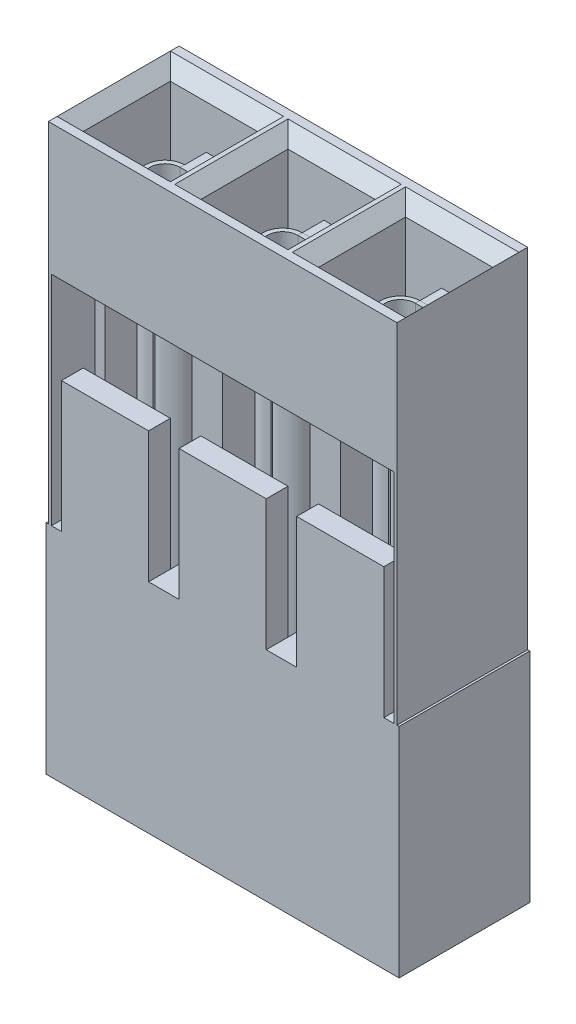
from build123d import *

# Parameters (mm, degrees)
SCHIZZO1_W                        = 8
SCHIZZO1_H                        = 8
ESTRUSIONE_ESTRUSIONE1_DEPTH      = 3
SCHIZZO2_W                        = 7.86
SCHIZZO2_H                        = 5
TAGLIO_ESTRUSIONE2_DEPTH          = 1
ESTRUSIONE_ESTRUSIONE2_DEPTH      = 1
ESTRUSIONE_ESTRUSIONE2_DEPTH_BACK = 2
SCHIZZO4_W                        = 8.1
SCHIZZO4_H                        = 5
TAGLIO_ESTRUSIONE3_DEPTH          = 14.942829698
TAGLIO_ESTRUSIONE3_DEPTH_BACK     = 14.942829698
SCHIZZO5_W                        = 2
SCHIZZO5_H                        = 2
SMUSSO2_SIZE                      = 0.3
SCHIZZO6_W                        = 2
SCHIZZO6_H                        = 0.5
ESTRUSIONE_ESTRUSIONE4_DEPTH      = 3
SCHIZZO7_W                        = 1.25
SCHIZZO7_H                        = 10
BASE_FLANGIA1_DEPTH               = 0.1
ORLO1_START                       = -7.3
ORLO1_DEPTH                       = 10
ORLO1_2_DEPTH                     = 10
ORLO2_START                       = -7.3
ORLO2_DEPTH                       = 10
ORLO2_2_DEPTH                     = 10
SCHIZZO17_W                       = 1.25
SCHIZZO17_H                       = 10
BASE_FLANGIA2_DEPTH               = 0.1
ORLO3_START                       = -7.3
ORLO3_DEPTH                       = 10
ORLO3_2_DEPTH                     = 10
SCHIZZO26_W                       = 1.25
SCHIZZO26_H                       = 10
BASE_FLANGIA3_DEPTH               = 0.1
ORLO4_START                       = -7.3
ORLO4_DEPTH                       = 10
ORLO4_2_DEPTH                     = 10
ORLO5_START                       = -7.3
ORLO5_DEPTH                       = 10
ORLO5_2_DEPTH                     = 10
ESTRUSIONE_ESTRUSIONE5_REACH      = 15.943
SCHIZZO37_W                       = 0.35
SCHIZZO37_H                       = 0.5


# Read off the part's stored shape, not the designer's step: Orlo1, Orlo2, Orlo3, Orlo4, Orlo5
# Sheet-metal steps are written as plain solids
with BuildPart() as part:
    # Schizzo1 → Estrusione-Estrusione1 (new body)
    with BuildSketch(Plane.XY):
        Rectangle(SCHIZZO1_W, SCHIZZO1_H)
    extrude(amount=ESTRUSIONE_ESTRUSIONE1_DEPTH)

    # Schizzo2 → Taglio-Estrusione2 (cut)
    with BuildSketch(Plane.XY.offset(3)):
        with Locations((0, -1.5)):
            Rectangle(SCHIZZO2_W, SCHIZZO2_H)
    extrude(amount=-TAGLIO_ESTRUSIONE2_DEPTH, mode=Mode.SUBTRACT)

    # Schizzo4 → Estrusione-Estrusione2 (add, two sides: drawn at the far end of the back side and taken through both)
    with BuildSketch(Plane.XY.offset(2).offset(-ESTRUSIONE_ESTRUSIONE2_DEPTH_BACK)):
        with Locations((0, -6.5)):
            Rectangle(SCHIZZO4_W, SCHIZZO4_H)
    extrude(amount=ESTRUSIONE_ESTRUSIONE2_DEPTH + ESTRUSIONE_ESTRUSIONE2_DEPTH_BACK)

    # Schizzo5 → Taglio-Estrusione3 (cut, two sides: drawn at the far end of the back side and taken through both)
    with BuildSketch(Plane.XZ.offset(9).offset(-TAGLIO_ESTRUSIONE3_DEPTH_BACK)):
        with Locations((-2.7, 1.5)):
            Rectangle(SCHIZZO5_W, SCHIZZO5_H)
        with Locations((0, 1.5)):
            Rectangle(SCHIZZO5_W, SCHIZZO5_H)
        with Locations((2.7, 1.5)):
            Rectangle(SCHIZZO5_W, SCHIZZO5_H)
    extrude(amount=TAGLIO_ESTRUSIONE3_DEPTH + TAGLIO_ESTRUSIONE3_DEPTH_BACK, mode=Mode.SUBTRACT)

    # Smusso2
    smusso2_edges = [part.edges().sort_by_distance(p)[0] for p in [
        (0, 4, 2.5),
        (0, 4, 0.5),
        (3.7, 4, 1.5),
        (1.7, 4, 1.5),
        (2.7, 4, 2.5),
        (2.7, 4, 0.5),
        (-1.7, 4, 1.5),
        (-3.7, 4, 1.5),
        (-2.7, 4, 2.5),
        (-2.7, 4, 0.5),
        (1, 4, 1.5),
        (-1, 4, 1.5),
    ]]
    chamfer(smusso2_edges, length=SMUSSO2_SIZE - 0.0001)  # a hair under: the kernel refuses the full size

    # Schizzo6 → Estrusione-Estrusione4 (add)
    with BuildSketch(Plane(origin=(0, -4, 0), x_dir=(1, 0, 0), z_dir=(0, 1, 0))):
        with Locations((-2.7, -2.75)):
            Rectangle(SCHIZZO6_W, SCHIZZO6_H)
        with Locations((0, -2.75)):
            Rectangle(SCHIZZO6_W, SCHIZZO6_H)
        with Locations((2.7, -2.75)):
            Rectangle(SCHIZZO6_W, SCHIZZO6_H)
    extrude(amount=ESTRUSIONE_ESTRUSIONE4_DEPTH)


with BuildPart() as body_2:
    # Schizzo7 → Base-Flangia1 (new body)
    with BuildSketch(Plane.XY.offset(1)):
        with Locations((-2.7, -2.3)):
            Rectangle(SCHIZZO7_W, SCHIZZO7_H)
    extrude(amount=BASE_FLANGIA1_DEPTH)

    # Orlo1 outline → Orlo1 (cut)
    with BuildSketch(Plane(origin=(0, 0, 0), x_dir=(1, 0, 0), z_dir=(0, 1, 0)).offset(ORLO1_START)):
        with BuildLine():
            ThreePointArc((-2.525, -1), (-2.375, -1.025735931), (-2.242157287, -1.1))
            Line((-2.242157287, -1.1), (-2.075, -1.1))
            Line((-2.075, -1.1), (-2.075, -1))
            Line((-2.075, -1), (-2.525, -1))
        make_face()
    extrude(amount=ORLO1_DEPTH, mode=Mode.SUBTRACT)

    # Orlo1 2 outline → Orlo1 2 (add)
    with BuildSketch(Plane(origin=(0, 0, 0), x_dir=(1, 0, 0), z_dir=(0, 1, 0)).offset(ORLO1_START)):
        with BuildLine():
            Line((-2.64470705, -1.778892417), (-2.678909064, -1.872861679))
            ThreePointArc((-2.678909064, -1.872861679), (-2.133228682, -1.671393845), (-2.242157287, -1.1))
            Line((-2.242157287, -1.1), (-2.525, -1.1))
            ThreePointArc((-2.525, -1.1), (-2.180317286, -1.510776862), (-2.64470705, -1.778892417))
        make_face()
    extrude(amount=ORLO1_2_DEPTH)

    # Orlo2 outline → Orlo2 (cut)
    with BuildSketch(Plane(origin=(0, 0, 0), x_dir=(1, 0, 0), z_dir=(0, 1, 0)).offset(ORLO2_START)):
        with BuildLine():
            Line((-3.325, -1.1), (-3.157842713, -1.1))
            ThreePointArc((-3.157842713, -1.1), (-3.025, -1.025735931), (-2.875, -1))
            Line((-2.875, -1), (-3.325, -1))
            Line((-3.325, -1), (-3.325, -1.1))
        make_face()
    extrude(amount=ORLO2_DEPTH, mode=Mode.SUBTRACT)

    # Orlo2 2 outline → Orlo2 2 (add)
    with BuildSketch(Plane(origin=(0, 0, 0), x_dir=(1, 0, 0), z_dir=(0, 1, 0)).offset(ORLO2_START)):
        with BuildLine():
            Line((-2.721090936, -1.872861679), (-2.75529295, -1.778892417))
            ThreePointArc((-2.75529295, -1.778892417), (-3.219682714, -1.510776862), (-2.875, -1.1))
            Line((-2.875, -1.1), (-3.157842713, -1.1))
            ThreePointArc((-3.157842713, -1.1), (-3.266771318, -1.671393845), (-2.721090936, -1.872861679))
        make_face()
    extrude(amount=ORLO2_2_DEPTH)

    # Estrusione-Estrusione5: up to this face of the body (flat: up to its plane)
    estrusione_estrusione5_end = Plane(body_2.part.faces().sort_by_distance((-2.7, 2.7, 1.015402922))[0])
    # Schizzo37 → Estrusione-Estrusione5 (add, up to the picked face)
    with BuildSketch(Plane.XZ.offset(9), mode=Mode.PRIVATE) as estrusione_estrusione5_sk1:
        with Locations((-2.7, 0.75)):
            Rectangle(SCHIZZO37_W, SCHIZZO37_H)
    estrusione_estrusione5_tool1 = split(extrude(estrusione_estrusione5_sk1.sketch, amount=-ESTRUSIONE_ESTRUSIONE5_REACH, mode=Mode.PRIVATE), bisect_by=estrusione_estrusione5_end, keep=Keep.BOTH, mode=Mode.PRIVATE)
    # Schizzo37 → Estrusione-Estrusione5 (add, up to the picked face)
    with BuildSketch(Plane.XZ.offset(9), mode=Mode.PRIVATE) as estrusione_estrusione5_sk2:
        with Locations((2.7, 0.75)):
            Rectangle(SCHIZZO37_W, SCHIZZO37_H)
    estrusione_estrusione5_tool2 = split(extrude(estrusione_estrusione5_sk2.sketch, amount=-ESTRUSIONE_ESTRUSIONE5_REACH, mode=Mode.PRIVATE), bisect_by=estrusione_estrusione5_end, keep=Keep.BOTH, mode=Mode.PRIVATE)
    # Schizzo37 → Estrusione-Estrusione5 (add, up to the picked face)
    with BuildSketch(Plane.XZ.offset(9), mode=Mode.PRIVATE) as estrusione_estrusione5_sk3:
        with Locations((0, 0.75)):
            Rectangle(SCHIZZO37_W, SCHIZZO37_H)
    estrusione_estrusione5_tool3 = split(extrude(estrusione_estrusione5_sk3.sketch, amount=-ESTRUSIONE_ESTRUSIONE5_REACH, mode=Mode.PRIVATE), bisect_by=estrusione_estrusione5_end, keep=Keep.BOTH, mode=Mode.PRIVATE)

    add(part.part)  # Estrusione-Estrusione5 merges part
    add(estrusione_estrusione5_tool1.solids().sort_by(Axis((-2.7, -9, 0.75), (0, 1, 0)))[0])
    add(estrusione_estrusione5_tool2.solids().sort_by(Axis((2.7, -9, 0.75), (0, 1, 0)))[0])
    add(estrusione_estrusione5_tool3.solids().sort_by(Axis((0, -9, 0.75), (0, 1, 0)))[0])


with BuildPart() as body_3:
    # Schizzo17 → Base-Flangia2 (new body)
    with BuildSketch(Plane.XY.offset(1)):
        with Locations((0, -2.3)):
            Rectangle(SCHIZZO17_W, SCHIZZO17_H)
    extrude(amount=BASE_FLANGIA2_DEPTH)

    # Orlo3 outline → Orlo3 (cut)
    with BuildSketch(Plane(origin=(0, 0, 0), x_dir=(1, 0, 0), z_dir=(0, 1, 0)).offset(ORLO3_START)):
        with BuildLine():
            Line((-0.625, -1.1), (-0.457842713, -1.1))
            ThreePointArc((-0.457842713, -1.1), (-0.325, -1.025735931), (-0.175, -1))
            Line((-0.175, -1), (-0.625, -1))
            Line((-0.625, -1), (-0.625, -1.1))
        make_face()
        with BuildLine():
            ThreePointArc((0.175, -1), (0.325, -1.025735931), (0.457842713, -1.1))
            Line((0.457842713, -1.1), (0.625, -1.1))
            Line((0.625, -1.1), (0.625, -1))
            Line((0.625, -1), (0.175, -1))
        make_face()
    extrude(amount=ORLO3_DEPTH, mode=Mode.SUBTRACT)

    # Orlo3 2 outline → Orlo3 2 (add)
    with BuildSketch(Plane(origin=(0, 0, 0), x_dir=(1, 0, 0), z_dir=(0, 1, 0)).offset(ORLO3_START)):
        with BuildLine():
            Line((-0.021090936, -1.872861679), (-0.05529295, -1.778892417))
            ThreePointArc((-0.05529295, -1.778892417), (-0.519682714, -1.510776862), (-0.175, -1.1))
            Line((-0.175, -1.1), (-0.457842713, -1.1))
            ThreePointArc((-0.457842713, -1.1), (-0.566771318, -1.671393845), (-0.021090936, -1.872861679))
        make_face()
        with BuildLine():
            Line((0.457842713, -1.1), (0.175, -1.1))
            ThreePointArc((0.175, -1.1), (0.519682714, -1.510776862), (0.05529295, -1.778892417))
            Line((0.05529295, -1.778892417), (0.021090936, -1.872861679))
            ThreePointArc((0.021090936, -1.872861679), (0.566771318, -1.671393845), (0.457842713, -1.1))
        make_face()
    extrude(amount=ORLO3_2_DEPTH)


with BuildPart() as body_4:
    # Schizzo26 → Base-Flangia3 (new body)
    with BuildSketch(Plane.XY.offset(1)):
        with Locations((2.7, -2.3)):
            Rectangle(SCHIZZO26_W, SCHIZZO26_H)
    extrude(amount=BASE_FLANGIA3_DEPTH)

    # Orlo4 outline → Orlo4 (cut)
    with BuildSketch(Plane(origin=(0, 0, 0), x_dir=(1, 0, 0), z_dir=(0, 1, 0)).offset(ORLO4_START)):
        with BuildLine():
            ThreePointArc((2.875, -1), (3.025, -1.025735931), (3.157842713, -1.1))
            Line((3.157842713, -1.1), (3.325, -1.1))
            Line((3.325, -1.1), (3.325, -1))
            Line((3.325, -1), (2.875, -1))
        make_face()
    extrude(amount=ORLO4_DEPTH, mode=Mode.SUBTRACT)

    # Orlo4 2 outline → Orlo4 2 (add)
    with BuildSketch(Plane(origin=(0, 0, 0), x_dir=(1, 0, 0), z_dir=(0, 1, 0)).offset(ORLO4_START)):
        with BuildLine():
            Line((2.75529295, -1.778892417), (2.721090936, -1.872861679))
            ThreePointArc((2.721090936, -1.872861679), (3.266771318, -1.671393845), (3.157842713, -1.1))
            Line((3.157842713, -1.1), (2.875, -1.1))
            ThreePointArc((2.875, -1.1), (3.219682714, -1.510776862), (2.75529295, -1.778892417))
        make_face()
    extrude(amount=ORLO4_2_DEPTH)

    # Orlo5 outline → Orlo5 (cut)
    with BuildSketch(Plane(origin=(0, 0, 0), x_dir=(1, 0, 0), z_dir=(0, 1, 0)).offset(ORLO5_START)):
        with BuildLine():
            Line((2.075, -1.1), (2.242157287, -1.1))
            ThreePointArc((2.242157287, -1.1), (2.375, -1.025735931), (2.525, -1))
            Line((2.525, -1), (2.075, -1))
            Line((2.075, -1), (2.075, -1.1))
        make_face()
    extrude(amount=ORLO5_DEPTH, mode=Mode.SUBTRACT)

    # Orlo5 2 outline → Orlo5 2 (add)
    with BuildSketch(Plane(origin=(0, 0, 0), x_dir=(1, 0, 0), z_dir=(0, 1, 0)).offset(ORLO5_START)):
        with BuildLine():
            Line((2.678909064, -1.872861679), (2.64470705, -1.778892417))
            ThreePointArc((2.64470705, -1.778892417), (2.180317286, -1.510776862), (2.525, -1.1))
            Line((2.525, -1.1), (2.242157287, -1.1))
            ThreePointArc((2.242157287, -1.1), (2.133228682, -1.671393845), (2.678909064, -1.872861679))
        make_face()
    extrude(amount=ORLO5_2_DEPTH)


solid = Compound([body_2.part, body_3.part, body_4.part])
